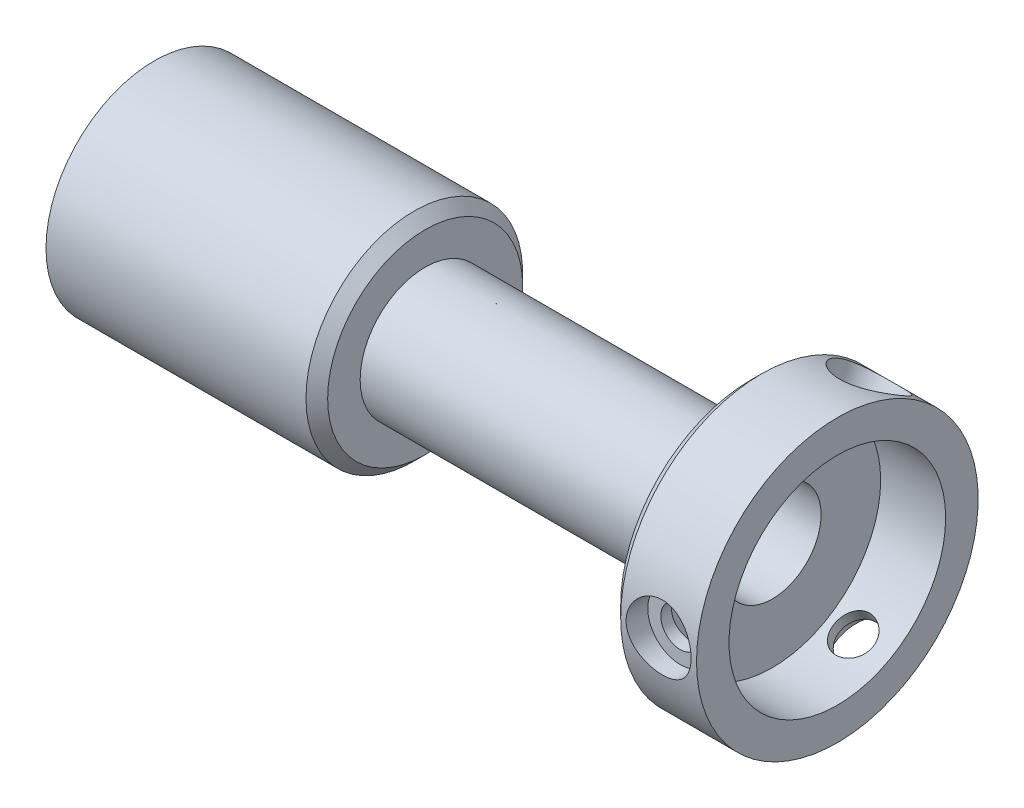
from build123d import *

# Parameters (mm, degrees)
SKETCH_2_R                = 10
CUT_EXTRUDE_1_DEPTH       = 6
SKETCH_3_R                = 4.5
CUT_EXTRUDE_2_DEPTH       = 66.675737529
HOLE_START                = 11
HOLE_WIZARD_1_OUTLINE_R   = 3
HOLE_WIZARD_1_DEPTH       = 2.000000102
HOLE_START_2              = 9.836666254
HOLE_WIZARD_1_2_OUTLINE_R = 1.8
HOLE_WIZARD_1_2_DEPTH     = 1.163333746
PATTERN_CIRCULAR_1_COUNT  = 3
PATTERN_CIRCULAR_2_COUNT  = 6
CHAMFER_1_SIZE            = 1


# Read off the part's stored shape, not the designer's step: 打孔尺寸(%根据)内六角圆柱头螺钉的类型1
with BuildPart() as part:
    # 草图1 → 旋转1 (revolve)
    with BuildSketch(Plane.XY, mode=Mode.PRIVATE) as revolve_1_sk:
        Polygon((0, 0), (0, 10), (25, 10), (25, 6), (55.05, 6), (55.05, 13), (63.05, 13), (63.05, 0), align=None)
    revolve(revolve_1_sk.sketch.rotate(Axis((-26.16483903, 0, 0), (1, 0, 0)), 90), axis=Axis((-26.16483903, 0, 0), (1, 0, 0)))

    # 草图2 → 切除-拉伸1 (cut)
    with BuildSketch(Plane(origin=(63.05, 0, 0), x_dir=(0, 0, -1), z_dir=(1, 0, 0))):
        with Locations(Location((0, 0, 0), (0, 0, 180))):
            Circle(SKETCH_2_R)
    extrude(amount=-CUT_EXTRUDE_1_DEPTH, mode=Mode.SUBTRACT)

    # 草图3 → 切除-拉伸2 (cut, through all)
    with BuildSketch(Plane.ZY):
        Circle(SKETCH_3_R)
    extrude(amount=-CUT_EXTRUDE_2_DEPTH, mode=Mode.SUBTRACT)

    # 打孔尺寸(%根据)内六角圆柱头螺钉的类型1 outline → 打孔尺寸(%根据)内六角圆柱头螺钉的类型1 (cut)
    with BuildSketch(Plane.XY.offset(HOLE_START)):
        with Locations((59.55, 0)):
            Circle(HOLE_WIZARD_1_OUTLINE_R)
    hole_wizard_1 = extrude(amount=HOLE_WIZARD_1_DEPTH, mode=Mode.SUBTRACT)

    # Hole Wizard 1 2 outline → Hole Wizard 1 2 (cut)
    with BuildSketch(Plane.XY.offset(HOLE_START_2)):
        with Locations((59.55, 0)):
            Circle(HOLE_WIZARD_1_2_OUTLINE_R)
    hole_wizard_1_2 = extrude(amount=HOLE_WIZARD_1_2_DEPTH, mode=Mode.SUBTRACT)

    # 阵列(圆周)1: 打孔尺寸(%根据)内六角圆柱头螺钉的类型1, Hole Wizard 1 2 ×3 about axis
    pattern_circular_1_axis = Axis((0, 0, 0), (1, 0, 0))
    add([hole_wizard_1.rotate(pattern_circular_1_axis, i * 360 / PATTERN_CIRCULAR_1_COUNT) for i in range(1, PATTERN_CIRCULAR_1_COUNT)], mode=Mode.SUBTRACT)
    add([hole_wizard_1_2.rotate(pattern_circular_1_axis, i * 360 / PATTERN_CIRCULAR_1_COUNT) for i in range(1, PATTERN_CIRCULAR_1_COUNT)], mode=Mode.SUBTRACT)

    # 草图10 → M3 螺纹孔1 (revolve, cut)
    with BuildSketch(Plane.ZX.offset(7.5)):
        Polygon((0, 0), (0, 8.251075774), (1.25, 7.5), (1.25, 0), align=None)
    hole_wizard_m3_1 = revolve(axis=Axis((-6.35, 7.5, 0), (1, 0, 0)), mode=Mode.SUBTRACT)

    # 阵列(圆周)2: M3 螺纹孔1 ×6 about axis
    pattern_circular_2_axis = Axis((0, 0, 0), (1, 0, 0))
    for i in range(1, PATTERN_CIRCULAR_2_COUNT):
        add(hole_wizard_m3_1.rotate(pattern_circular_2_axis, i * 360 / PATTERN_CIRCULAR_2_COUNT), mode=Mode.SUBTRACT)

    # 倒角1
    chamfer_1_edges = [part.edges().sort_by_distance(p)[0] for p in [
        (55.05, 0, -13),
        (25, 0, -10),
    ]]
    chamfer(chamfer_1_edges, length=CHAMFER_1_SIZE)


solid = part.part
